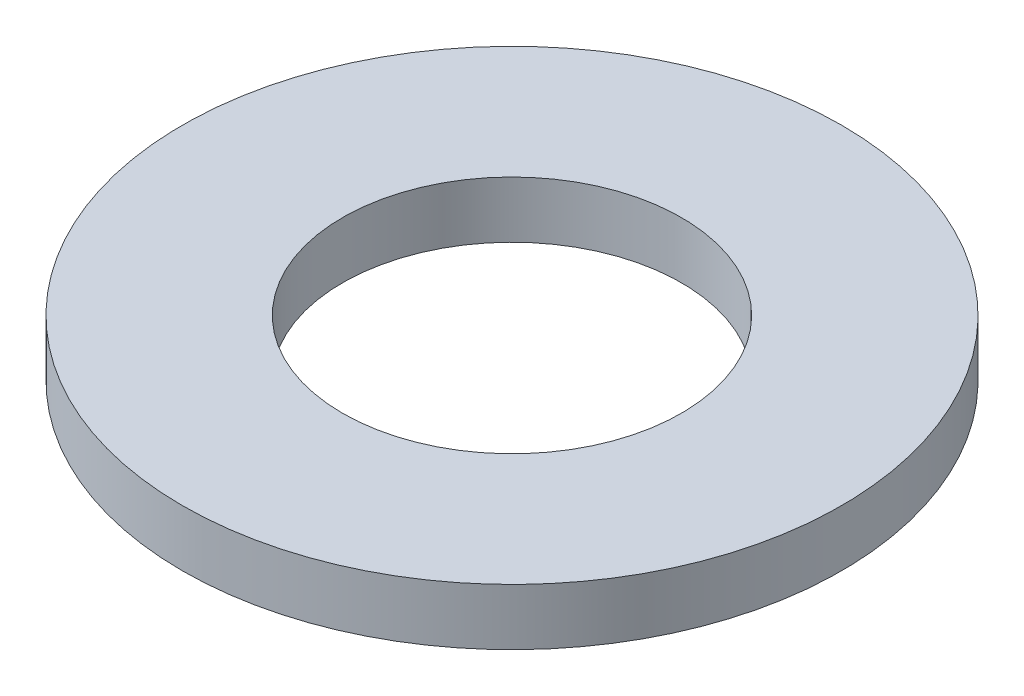
from build123d import *

# Parameters (mm, degrees)
SKETCH1_R           = 87.5
BOSS_EXTRUDE1_DEPTH = 15
SKETCH2_R           = 45
CUT_EXTRUDE1_DEPTH  = 125.649508623


with BuildPart() as part:
    # Sketch1 → Boss-Extrude1 (new body)
    with BuildSketch(Plane(origin=(0, 0, 0), x_dir=(1, 0, 0), z_dir=(0, 1, 0))):
        Circle(SKETCH1_R)
    extrude(amount=BOSS_EXTRUDE1_DEPTH)

    # Sketch2 → Cut-Extrude1 (cut, through all)
    with BuildSketch(Plane(origin=(0, 0, 0), x_dir=(1, 0, 0), z_dir=(0, 1, 0))):
        Circle(SKETCH2_R)
    extrude(amount=CUT_EXTRUDE1_DEPTH, mode=Mode.SUBTRACT)


solid = part.part
